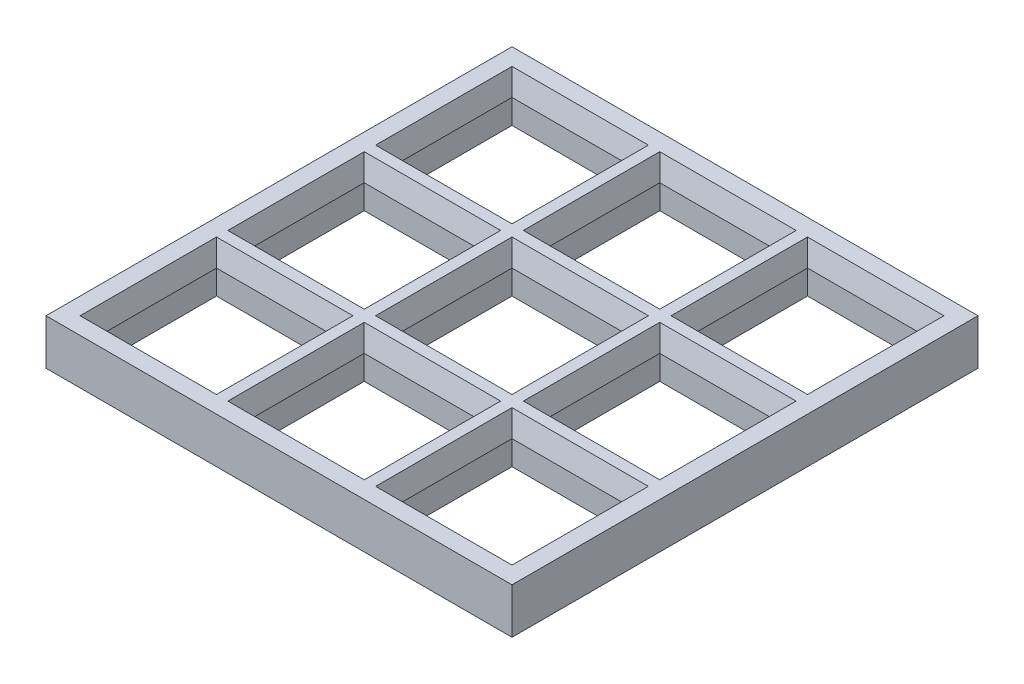
from build123d import *

# Parameters (mm, degrees)
SKETCH2_W            = 205
SKETCH2_H            = 205
BOSS_EXTRUDE1_DEPTH  = 20
SKETCH3_W            = 55
SKETCH3_H            = 55
CUT_EXTRUDE1_DEPTH   = 147.330106267
LPATTERN1_COUNT      = 3
LPATTERN1_PITCH      = 65
LPATTERN1_COUNT_DIR2 = 3
LPATTERN1_PITCH_DIR2 = 65
CHAMFER1_SIZE        = 2.5
CHAMFER1_SIZE2       = 9.330127019


with BuildPart() as part:
    # Sketch2 → Boss-Extrude1 (new body)
    with BuildSketch(Plane(origin=(0, 0, 0), x_dir=(1, 0, 0), z_dir=(0, 1, 0))):
        Rectangle(SKETCH2_W, SKETCH2_H)
    extrude(amount=BOSS_EXTRUDE1_DEPTH)

    # Sketch3 → Cut-Extrude1 (cut, through all)
    with BuildSketch(Plane(origin=(0, 20, 0), x_dir=(1, 0, 0), z_dir=(0, 1, 0))):
        with Locations((-65, 65)):
            Rectangle(SKETCH3_W, SKETCH3_H)
    cut_extrude1 = extrude(amount=-CUT_EXTRUDE1_DEPTH, mode=Mode.SUBTRACT)

    # LPattern1: Cut-Extrude1 3 × 3
    with Locations(*[(i * LPATTERN1_PITCH, 0, j * LPATTERN1_PITCH_DIR2) for i in range(LPATTERN1_COUNT) for j in range(LPATTERN1_COUNT_DIR2) if (i, j) != (0, 0)]):
        add(cut_extrude1, mode=Mode.SUBTRACT)

    # Chamfer1
    chamfer1_edges = [part.edges().sort_by_distance(p)[0] for p in [
        (65, 20, 37.5),
        (37.5, 20, 65),
        (65, 20, 92.5),
        (92.5, 20, 65),
        (0, 20, 37.5),
        (-27.5, 20, 65),
        (0, 20, 92.5),
        (27.5, 20, 65),
        (-65, 20, 37.5),
        (-92.5, 20, 65),
        (-65, 20, 92.5),
        (-37.5, 20, 65),
        (65, 20, -27.5),
        (37.5, 20, 0),
        (65, 20, 27.5),
        (92.5, 20, 0),
        (0, 20, -27.5),
        (-27.5, 20, 0),
        (0, 20, 27.5),
        (27.5, 20, 0),
        (65, 20, -92.5),
        (37.5, 20, -65),
        (65, 20, -37.5),
        (92.5, 20, -65),
        (-65, 20, -92.5),
        (-92.5, 20, -65),
        (-65, 20, -37.5),
        (-37.5, 20, -65),
        (0, 20, -92.5),
        (-27.5, 20, -65),
        (0, 20, -37.5),
        (27.5, 20, -65),
        (-92.5, 20, 0),
        (-65, 20, 27.5),
        (-37.5, 20, 0),
        (-65, 20, -27.5),
    ]]
    chamfer1_side = [part.faces().sort_by_distance(p)[0] for p in [
        (0, 20, 99.600862197),
    ]]
    chamfer(chamfer1_edges, length=CHAMFER1_SIZE, length2=CHAMFER1_SIZE2, reference=chamfer1_side[0])


solid = part.part
